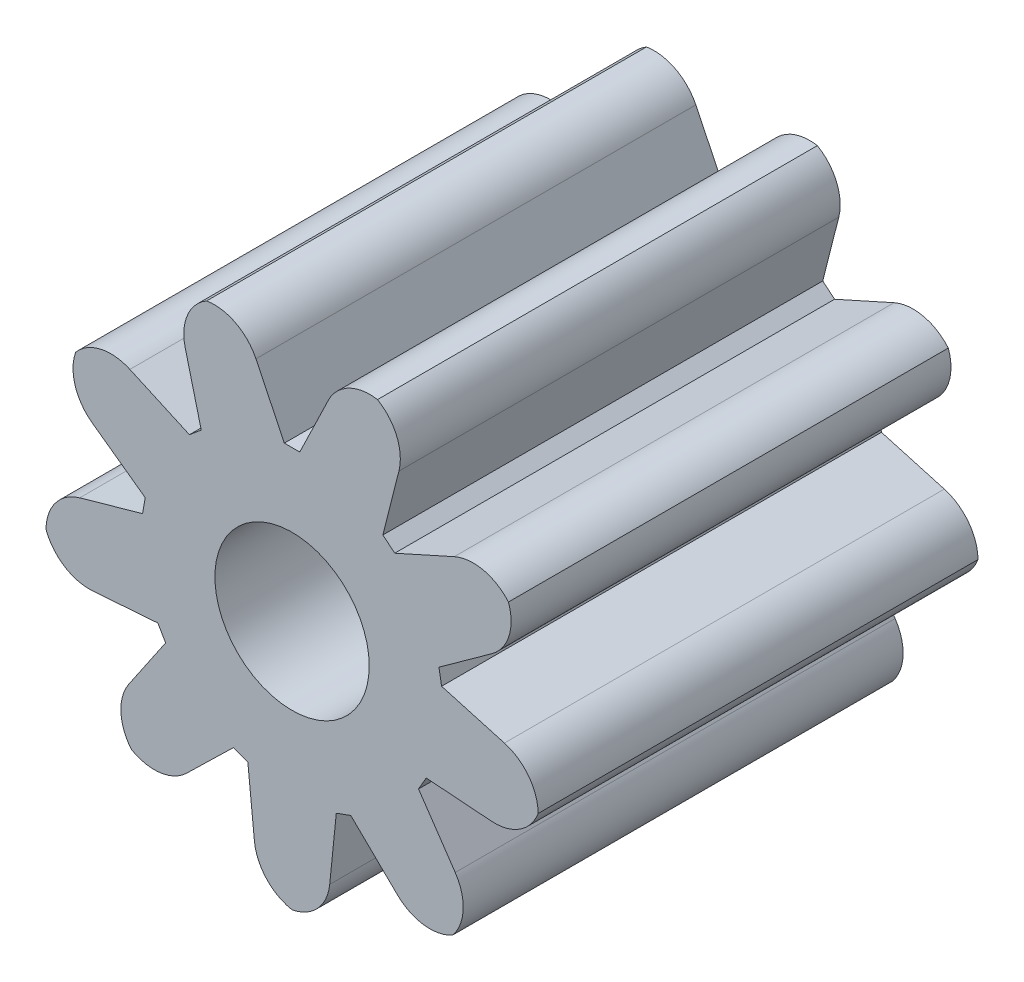
from build123d import *

# Parameters (mm, degrees)
SKETCH2_R           = 0.5
BOSS_EXTRUDE1_DEPTH = 2.85
FILLET2_R           = 0.3
FILLET3_R           = 0.3


with BuildPart() as part:
    # Sketch2 → Boss-Extrude1 (new body)
    with BuildSketch(Plane.XY):
        with BuildLine():
            Line((-0.819411063, -0.530738407), (-1.201999847, -1.093536176))
            ThreePointArc((-1.201999847, -1.093536176), (-1.044529866, -1.24482222), (-0.868197821, -1.373629332))
            Line((-0.868197821, -1.373629332), (-0.38038606, -0.899124125))
            Line((-0.38038606, -0.899124125), (-0.286553219, -0.933276486))
            Line((-0.286553219, -0.933276486), (-0.217873799, -1.610327919))
            ThreePointArc((-0.217873799, -1.610327919), (0, -1.625), (0.217873799, -1.610327919))
            Line((0.217873799, -1.610327919), (0.286553219, -0.933276486))
            Line((0.286553219, -0.933276486), (0.38038606, -0.899124125))
            Line((0.38038606, -0.899124125), (0.868197821, -1.373629332))
            ThreePointArc((0.868197821, -1.373629332), (1.044529866, -1.24482222), (1.201999847, -1.093536176))
            Line((1.201999847, -1.093536176), (0.819411063, -0.530738407))
            Line((0.819411063, -0.530738407), (0.869338475, -0.444261593))
            Line((0.869338475, -0.444261593), (1.548030032, -0.494194315))
            ThreePointArc((1.548030032, -0.494194315), (1.600312599, -0.282178289), (1.623696808, -0.065066703))
            Line((1.623696808, -0.065066703), (0.968857363, 0.120138071))
            Line((0.968857363, 0.120138071), (0.951517755, 0.218475876))
            Line((0.951517755, 0.218475876), (1.503521786, 0.616479715))
            ThreePointArc((1.503521786, 0.616479715), (1.407291281, 0.8125), (1.285647987, 0.993848204))
            Line((1.285647987, 0.993848204), (0.664964536, 0.71480061))
            Line((0.664964536, 0.71480061), (0.588471303, 0.778986054))
            Line((0.588471303, 0.778986054), (0.755498987, 1.438696035))
            ThreePointArc((0.755498987, 1.438696035), (0.555782733, 1.527000509), (0.346030185, 1.587730491))
            Line((0.346030185, 1.587730491), (0.049927412, 0.975))
            Line((0.049927412, 0.975), (-0.049927412, 0.975))
            Line((-0.049927412, 0.975), (-0.346030185, 1.587730491))
            ThreePointArc((-0.346030185, 1.587730491), (-0.555782733, 1.527000509), (-0.755498987, 1.438696035))
            Line((-0.755498987, 1.438696035), (-0.588471303, 0.778986054))
            Line((-0.588471303, 0.778986054), (-0.664964536, 0.71480061))
            Line((-0.664964536, 0.71480061), (-1.285647987, 0.993848204))
            ThreePointArc((-1.285647987, 0.993848204), (-1.407291281, 0.8125), (-1.503521786, 0.616479715))
            Line((-1.503521786, 0.616479715), (-0.951517755, 0.218475876))
            Line((-0.951517755, 0.218475876), (-0.968857363, 0.120138071))
            Line((-0.968857363, 0.120138071), (-1.623696808, -0.065066703))
            ThreePointArc((-1.623696808, -0.065066703), (-1.600312599, -0.282178289), (-1.548030032, -0.494194315))
            Line((-1.548030032, -0.494194315), (-0.869338475, -0.444261593))
            Line((-0.869338475, -0.444261593), (-0.819411063, -0.530738407))
        make_face()
        Circle(SKETCH2_R, mode=Mode.SUBTRACT)
    extrude(amount=BOSS_EXTRUDE1_DEPTH)

    # Fillet2
    # the kernel refuses this fillet: 0.3 mm, written as the material it takes off along each edge
    with BuildSketch(Plane(origin=(-0.755498987, 1.438696035, -0.712889988), x_dir=(0.9227293829485229, 0.38544842176799504, 0), z_dir=(0, 0, 1))) as fillet2_piece_1:
        with BuildLine():
            CenterArc((0.258833903, -0.298843015), FILLET2_R, 84.966378176, 86.569826399)
            Line((-0.037898816, -0.254687685), (0, 0))
            ThreePointArc((0, 0), (0.142577998, 0.006267003), (0.285155995, 0))
        make_face()
    extrude(amount=4.275779976, mode=Mode.SUBTRACT)
    with BuildSketch(Plane(origin=(-0.346030185, 1.587730491, -0.712889988), x_dir=(0.4351087462469743, -0.9003779089578919, 0), z_dir=(0, 0, 1))) as fillet2_piece_2:
        with BuildLine():
            CenterArc((0.257492014, -0.3), FILLET2_R, 90, 86.569826399)
            ThreePointArc((-0.041970524, -0.28205038), (-0.027184012, -0.140102785), (0, 0))
            Line((0, 0), (0.257492014, 0))
        make_face()
    extrude(amount=4.275779976, mode=Mode.SUBTRACT)

    # Fillet3
    # the kernel refuses this fillet: 0.3 mm, written as the material it takes off along each edge
    with BuildSketch(Plane(origin=(-1.285647987, 0.993848204, -0.712889988), x_dir=(-0.5398228699721833, -0.8417786342352693, 0), z_dir=(0, 0, 1)), Plane(origin=(-1.201999847, -1.093536176, -0.712889988), x_dir=(0.7352508676813189, -0.6777950734358195, 0), z_dir=(0, 0, 1)), Plane(origin=(-0.217873799, -1.610327919, -0.712889988), x_dir=(0.998913116596804, -0.04661100182209958, 0), z_dir=(0, 0, 1)), Plane(origin=(0.868197821, -1.373629332, -0.712889988), x_dir=(0.795172816573963, 0.6063828755677642, 0), z_dir=(0, 0, 1)), Plane(origin=(1.548030032, -0.494194315, -0.712889988), x_dir=(0.21936231831469838, 0.9756434662844828, 0), z_dir=(0, 0, 1)), Plane(origin=(1.503521786, 0.616479715, -0.712889988), x_dir=(-0.45909024662462017, 0.8883896360573694, 0), z_dir=(0, 0, 1)), Plane(origin=(0.755498987, 1.438696035, -0.712889988), x_dir=(-0.922729382948523, 0.38544842176799504, 0), z_dir=(0, 0, 1))) as fillet3_piece_1:
        with BuildLine():
            CenterArc((0.258833903, 0.298843015), FILLET3_R, 188.463795424, 86.569826399)
            Line((-0.037898816, 0.254687685), (0, 0))
            ThreePointArc((0, 0), (0.142577998, -0.006267003), (0.285155995, 0))
        make_face()
    extrude(amount=4.275779976, mode=Mode.SUBTRACT)
    with BuildSketch(Plane(origin=(-1.503521786, 0.616479715, -0.712889988), x_dir=(0.8111433045099228, -0.5848474498095403, 0), z_dir=(0, 0, 1)), Plane(origin=(-1.548030032, -0.494194315, -0.712889988), x_dir=(0.9973045152873341, 0.07337372682026923, 0), z_dir=(0, 0, 1)), Plane(origin=(-0.868197821, -1.373629332, -0.712889988), x_dir=(0.7168158595567345, 0.6972625212127351, 0), z_dir=(0, 0, 1)), Plane(origin=(0.217873799, -1.610327919, -0.712889988), x_dir=(0.1009210966186461, 0.9948944327200197, 0), z_dir=(0, 0, 1)), Plane(origin=(1.201999847, -1.093536176, -0.712889988), x_dir=(-0.5621957690403601, 0.8270041821376227, 0), z_dir=(0, 0, 1)), Plane(origin=(1.623696808, -0.065066703, -0.712889988), x_dir=(-0.962254986255382, 0.2721494836053427, 0), z_dir=(0, 0, 1)), Plane(origin=(1.285647987, 0.993848204, -0.712889988), x_dir=(-0.912064401128568, -0.41004698291047903, 0), z_dir=(0, 0, 1)), Plane(origin=(0.346030185, 1.587730491, -0.712889988), x_dir=(-0.435108746246974, -0.9003779089578923, 0), z_dir=(0, 0, 1))) as fillet3_piece_2:
        with BuildLine():
            CenterArc((0.257492014, 0.3), FILLET3_R, 183.430173601, 86.569826399)
            ThreePointArc((-0.041970524, 0.28205038), (-0.027184012, 0.140102785), (0, 0))
            Line((0, 0), (0.257492014, 0))
        make_face()
    extrude(amount=4.275779976, mode=Mode.SUBTRACT)
    with BuildSketch(Plane(origin=(-1.623696808, -0.065066703, -0.712889988), x_dir=(0.9622549862553823, 0.27214948360534136, 0), z_dir=(0, 0, 1))) as fillet3_piece_3:
        with BuildLine():
            CenterArc((0.257492014, -0.3), FILLET3_R, 90, 86.569826399)
            ThreePointArc((-0.041970524, -0.28205038), (-0.027184012, -0.140102785), (0, 0))
            Line((0, 0), (0.257492014, 0))
        make_face()
    extrude(amount=4.275779976, mode=Mode.SUBTRACT)


solid = part.part
